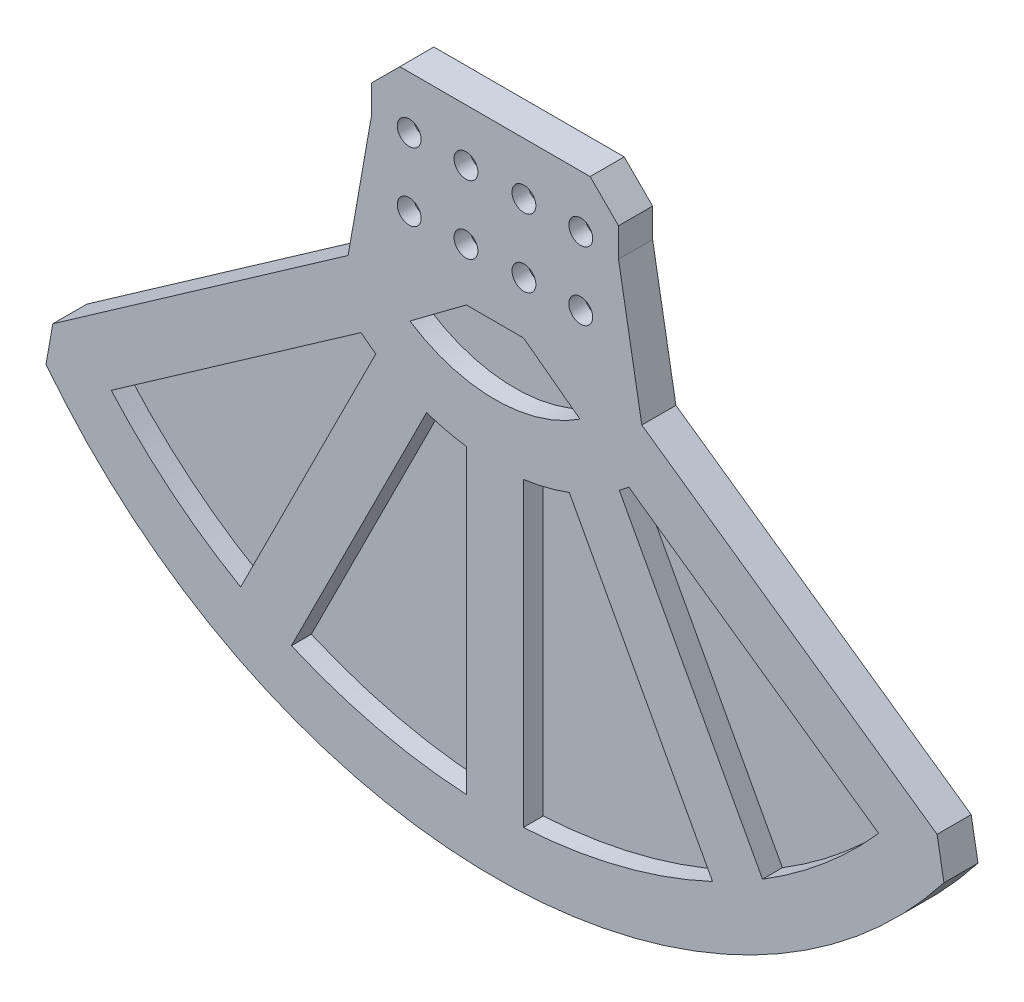
from build123d import *

# Parameters (mm, degrees)
SKETCH_1_R          = 1.1
EXTRUDE_1_DEPTH     = 6
EXTRUDE_2_DEPTH     = 2.5
SKETCH_2_R          = 2.1
CUT_EXTRUDE_1_DEPTH = 2.8
CHAMFER_1_SIZE      = 5
CHAMFER_2_SIZE      = 5
CHAMFER_2_SIZE_2    = 20.362059886


with BuildPart() as part:
    # 스케치1 → 보스-돌출1 (new body)
    # profile 1 of 3: a face of its own
    with BuildSketch(Plane.XY):
        with BuildLine():
            Line((81.914344353, -51.358871931), (21.75, -9.23))
            Line((21.75, -9.23), (5.029063305, -9.23))
            Line((5.029063305, -9.23), (14.961256377, -16.641470968))
            ThreePointArc((14.961256377, -16.641470968), (0, -21.138080256), (-14.961256377, -16.641470968))
            Line((-14.961256377, -16.641470968), (-5.029063305, -9.23))
            Line((-5.029063305, -9.23), (-21.75, -9.23))
            Line((-21.75, -9.23), (-81.914344353, -51.358871931))
            ThreePointArc((-81.914344353, -51.358871931), (0, -94), (81.914344353, -51.358871931))
        make_face()
        with BuildLine():
            ThreePointArc((-23.561943602, -22.706651125), (-22.285743682, -23.708292339), (-20.967016307, -24.653241791))
            Line((-20.967016307, -24.653241791), (-44.754559097, -72.083477382))
            ThreePointArc((-44.754559097, -72.083477382), (-56.906680731, -63.725387688), (-67.530529729, -53.494769135))
            Line((-67.530529729, -53.494769135), (-23.561943602, -22.706651125))
        make_face(mode=Mode.SUBTRACT)
        with BuildLine():
            ThreePointArc((-12.028210812, -29.136293911), (-8.554644148, -30.139383899), (-5, -30.799959309))
            Line((-5, -30.799959309), (-5, -83.861003778))
            ThreePointArc((-5, -83.861003778), (-20.731227032, -81.579770642), (-35.815753602, -76.566529502))
            Line((-35.815753602, -76.566529502), (-12.028210812, -29.136293911))
        make_face(mode=Mode.SUBTRACT)
        with BuildLine():
            Line((5, -83.861003778), (5, -30.799959309))
            ThreePointArc((5, -30.799959309), (9.099152416, -30.006144343), (13.08329394, -28.757221189))
            Line((13.08329394, -28.757221189), (38.291645519, -75.447835351))
            ThreePointArc((38.291645519, -75.447835351), (22.050782156, -81.256879421), (5, -83.861003778))
        make_face(mode=Mode.SUBTRACT)
        with BuildLine():
            ThreePointArc((21.88270877, -24.006400351), (22.731617723, -23.36853011), (23.561943602, -22.706651125))
            Line((23.561943602, -22.706651125), (67.530529729, -53.494769135))
            ThreePointArc((67.530529729, -53.494769135), (57.952623233, -62.858503182), (47.09106035, -70.697014513))
            Line((47.09106035, -70.697014513), (21.88270877, -24.006400351))
        make_face(mode=Mode.SUBTRACT)
    # profile 2 of 3: a face of its own
    with BuildSketch(Plane.XY):
        Polygon((5.029063305, -9.23), (21.75, -9.23), (0, 6), (-21.75, -9.23), (-5.029063305, -9.23), align=None)
        with Locations((-5.1, 0)):
            Circle(SKETCH_1_R, mode=Mode.SUBTRACT)
        with Locations((5.1, 0)):
            Circle(SKETCH_1_R, mode=Mode.SUBTRACT)
    # profile 3 of 3: a face of its own
    with BuildSketch(Plane.XY):
        Polygon((21.75, -9.23), (21.75, 21.23), (-21.75, 21.23), (-21.75, -9.23), (0, 6), align=None)
        with Locations((-15.1, 0)):
            Circle(SKETCH_1_R, mode=Mode.SUBTRACT)
        with Locations((-15.1, 12)):
            Circle(SKETCH_1_R, mode=Mode.SUBTRACT)
        with Locations((-5.1, 12)):
            Circle(SKETCH_1_R, mode=Mode.SUBTRACT)
        with Locations((15.1, 0)):
            Circle(SKETCH_1_R, mode=Mode.SUBTRACT)
        with Locations((5.1, 12)):
            Circle(SKETCH_1_R, mode=Mode.SUBTRACT)
        with Locations((15.1, 12)):
            Circle(SKETCH_1_R, mode=Mode.SUBTRACT)
    extrude(amount=EXTRUDE_1_DEPTH)

    # 스케치1<3> → 보스-돌출2 (add)
    with BuildSketch(Plane.XY):
        with BuildLine():
            Line((-23.561943602, -22.706651125), (-67.530529729, -53.494769135))
            ThreePointArc((-67.530529729, -53.494769135), (-56.906680731, -63.725387688), (-44.754559097, -72.083477382))
            Line((-44.754559097, -72.083477382), (-20.967016307, -24.653241791))
            ThreePointArc((-20.967016307, -24.653241791), (-22.285743682, -23.708292339), (-23.561943602, -22.706651125))
        make_face()
        with BuildLine():
            ThreePointArc((-12.028210812, -29.136293911), (-8.554644148, -30.139383899), (-5, -30.799959309))
            Line((-5, -30.799959309), (-5, -83.861003778))
            ThreePointArc((-5, -83.861003778), (-20.731227032, -81.579770642), (-35.815753602, -76.566529502))
            Line((-35.815753602, -76.566529502), (-12.028210812, -29.136293911))
        make_face()
        with BuildLine():
            ThreePointArc((5, -30.799959309), (9.099152416, -30.006144343), (13.08329394, -28.757221189))
            Line((13.08329394, -28.757221189), (38.291645519, -75.447835351))
            ThreePointArc((38.291645519, -75.447835351), (22.050782156, -81.256879421), (5, -83.861003778))
            Line((5, -83.861003778), (5, -30.799959309))
        make_face()
        with BuildLine():
            ThreePointArc((21.88270877, -24.006400351), (22.731617723, -23.36853011), (23.561943602, -22.706651125))
            Line((23.561943602, -22.706651125), (67.530529729, -53.494769135))
            ThreePointArc((67.530529729, -53.494769135), (57.952623233, -62.858503182), (47.09106035, -70.697014513))
            Line((47.09106035, -70.697014513), (21.88270877, -24.006400351))
        make_face()
        with BuildLine():
            Line((14.961256377, -16.641470968), (5.029063305, -9.23))
            Line((5.029063305, -9.23), (-5.029063305, -9.23))
            Line((-5.029063305, -9.23), (-14.961256377, -16.641470968))
            ThreePointArc((-14.961256377, -16.641470968), (0, -21.138080256), (14.961256377, -16.641470968))
        make_face()
    extrude(amount=EXTRUDE_2_DEPTH)

    # 스케치2 → 컷-돌출1 (cut)
    with BuildSketch(Plane.XY.offset(6)):
        with Locations((-15.1, 12)):
            Circle(SKETCH_2_R)
        with Locations((-5.1, 12)):
            Circle(SKETCH_2_R)
        with Locations((5.1, 12)):
            Circle(SKETCH_2_R)
        with Locations((15.1, 12)):
            Circle(SKETCH_2_R)
        with Locations((15.1, 0)):
            Circle(SKETCH_2_R)
        with Locations((5.1, 0)):
            Circle(SKETCH_2_R)
        with Locations((-5.1, 0)):
            Circle(SKETCH_2_R)
        with Locations((-15.1, 0)):
            Circle(SKETCH_2_R)
    extrude(amount=-CUT_EXTRUDE_1_DEPTH, mode=Mode.SUBTRACT)

    # 모따기1
    chamfer_1_edges = [part.edges().sort_by_distance(p)[0] for p in [
        (-21.75, 21.23, 3),
        (21.75, 21.23, 3),
    ]]
    chamfer(chamfer_1_edges, length=CHAMFER_1_SIZE)

    # 모따기2
    # the kernel refuses this chamfer: 20.362059886, 5 mm, written as the material it adds along each edge
    with BuildSketch(Plane(origin=(-21.75, -9.23, 0), x_dir=(-0.8191434435315306, -0.573588719309669, 0), z_dir=(0, 0, 1))) as chamfer_2_piece_1:
        Polygon((CHAMFER_2_SIZE, 0), (-CHAMFER_2_SIZE_2 * 0.573588719322, -CHAMFER_2_SIZE_2 * 0.819143443549), (0, 0), align=None)
    extrude(amount=6)
    with BuildSketch(Plane(origin=(21.75, -9.23, 0), x_dir=(0, 1, 0), z_dir=(0, 0, 1))) as chamfer_2_piece_2:
        Polygon((CHAMFER_2_SIZE_2, 0), (-CHAMFER_2_SIZE * 0.57358871931, -CHAMFER_2_SIZE * 0.819143443532), (0, 0), align=None)
    extrude(amount=6)
    # the kernel refuses this chamfer: 20.362059886, 5 mm, written as the material it takes off along each edge
    with BuildSketch(Plane(origin=(81.914344353, -51.358871931, -12.85841494), x_dir=(-0.8191434435315298, 0.5735887193096699, 0), z_dir=(0, 0, 1))) as chamfer_2_2_piece_1:
        with BuildLine():
            Line((CHAMFER_2_SIZE, 0), (0.119182901, 4.880817099))
            ThreePointArc((0.119182901, 4.880817099), (0.031506692, 2.510048959), (0, 0))
            Line((0, 0), (CHAMFER_2_SIZE, 0))
        make_face()
    extrude(amount=31.71682988, mode=Mode.SUBTRACT)
    with BuildSketch(Plane(origin=(-81.914344353, -51.358871931, -12.85841494), x_dir=(0.5934141945147567, -0.8048972566411209, 0), z_dir=(0, 0, 1))) as chamfer_2_2_piece_2:
        with BuildLine():
            Line((4.882272025, 0), (CHAMFER_2_SIZE * 0.0244113601227, CHAMFER_2_SIZE * 0.999701998346))
            Line((CHAMFER_2_SIZE * 0.0244113601227, CHAMFER_2_SIZE * 0.999701998346), (0, 0))
            ThreePointArc((0, 0), (2.510070082, -0.029776406), (4.882272025, 0))
        make_face()
    extrude(amount=31.71682988, mode=Mode.SUBTRACT)


solid = part.part
